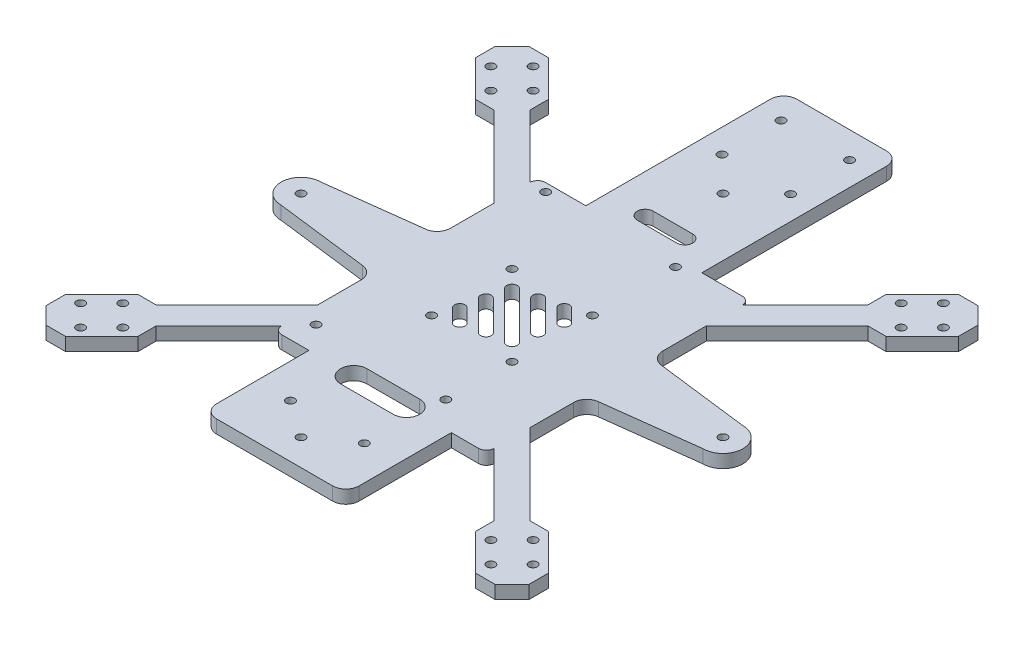
from build123d import *

# Parameters (mm, degrees)
SKETCH_1_R          = 1.6
EXTRUDE_1_DEPTH     = 5
SKETCH_6_R          = 1.6
EXTRUDE_3_DEPTH     = 5
SKETCH_7_R          = 1.6
CUT_EXTRUDE_5_DEPTH = 130.541966274
SKETCH_8_W          = 44
SKETCH_8_H          = 75
SKETCH_8_R          = 1.6
EXTRUDE_4_DEPTH     = 5
FILLET_1_R          = 5
FILLET_2_R          = 3


with BuildPart() as part:
    # 草图1 → 凸台-拉伸1 (new body)
    with BuildSketch(Plane(origin=(0, 0, 0), x_dir=(1, 0, 0), z_dir=(0, 1, 0))):
        with BuildLine():
            Line((-40.28, -16.916429648), (-40.28, -50))
            Line((-40.28, -50), (-27, -50))
            Line((-27, -50), (-27, -90))
            Line((-27, -90), (27, -90))
            Line((27, -90), (27, -50))
            Line((27, -50), (40.28, -50))
            Line((40.28, -50), (40.28, -16.916429648))
            ThreePointArc((40.28, -16.916429648), (41.5325458, -13.606356081), (44.662634807, -11.954690012))
            Line((44.662634807, -11.954690012), (80, -7.557833088))
            ThreePointArc((80, -7.557833088), (87.557833088, 0), (80, 7.557833088))
            Line((80, 7.557833088), (44.662634807, 11.954690012))
            ThreePointArc((44.662634807, 11.954690012), (41.5325458, 13.606356081), (40.28, 16.916429648))
            Line((40.28, 16.916429648), (40.28, 50))
            Line((40.28, 50), (-40.28, 50))
            Line((-40.28, 50), (-40.28, 16.916429648))
            ThreePointArc((-40.28, 16.916429648), (-41.5325458, 13.606356081), (-44.662634807, 11.954690012))
            Line((-44.662634807, 11.954690012), (-80, 7.557833088))
            ThreePointArc((-80, 7.557833088), (-87.557833088, 0), (-80, -7.557833088))
            Line((-80, -7.557833088), (-44.662634807, -11.954690012))
            ThreePointArc((-44.662634807, -11.954690012), (-41.5325458, -13.606356081), (-40.28, -16.916429648))
        make_face()
        with Locations(Location((-34.12, -40.19, 0), (0, 0, 270))):
            Circle(SKETCH_1_R, mode=Mode.SUBTRACT)
        with Locations(Location((15.09, -40.19, 0), (0, 0, 270))):
            Circle(SKETCH_1_R, mode=Mode.SUBTRACT)
        with Locations(Location((-80, 0, 0), (0, 0, 270))):
            Circle(SKETCH_1_R, mode=Mode.SUBTRACT)
        with Locations(Location((-15.25, -15.25, 0), (0, 0, 270))):
            Circle(SKETCH_1_R, mode=Mode.SUBTRACT)
        with Locations(Location((-15.25, 15.25, 0), (0, 0, 270))):
            Circle(SKETCH_1_R, mode=Mode.SUBTRACT)
        with Locations(Location((-34.12, 46.89, 0), (0, 0, 270))):
            Circle(SKETCH_1_R, mode=Mode.SUBTRACT)
        with Locations(Location((15.25, -15.25, 0), (0, 0, 270))):
            Circle(SKETCH_1_R, mode=Mode.SUBTRACT)
        with Locations(Location((80, 0, 0), (0, 0, 270))):
            Circle(SKETCH_1_R, mode=Mode.SUBTRACT)
        with Locations(Location((15.25, 15.25, 0), (0, 0, 270))):
            Circle(SKETCH_1_R, mode=Mode.SUBTRACT)
        with Locations(Location((15.09, 46.89, 0), (0, 0, 270))):
            Circle(SKETCH_1_R, mode=Mode.SUBTRACT)
        with Locations(Location((14, -70, 0), (0, 0, 270))):
            Circle(SKETCH_1_R, mode=Mode.SUBTRACT)
        with Locations(Location((-14, -70, 0), (0, 0, 270))):
            Circle(SKETCH_1_R, mode=Mode.SUBTRACT)
    extrude(amount=EXTRUDE_1_DEPTH)

    # 草图6 → 凸台-拉伸3 (add)
    # profile 1 of 4: a face of its own
    with BuildSketch(Plane(origin=(0, 0, 0), x_dir=(1, 0, 0), z_dir=(0, 1, 0))):
        Polygon((-40.28, 33.405), (-40.28, 47.155), (-64.031745931, 70.906745931), (-64.031745931, 77.781745931), (-77.781745931, 91.531745931), (-85.1677849, 91.531745931), (-91.531745931, 85.1677849), (-91.531745931, 77.781745931), (-77.781745931, 64.031745931), (-70.906745931, 64.031745931), align=None)
        with Locations(Location((-85.781745931, 77.781745931, 0), (0, 0, 270))):
            Circle(SKETCH_6_R, mode=Mode.SUBTRACT)
        with Locations(Location((-77.781745931, 69.781745931, 0), (0, 0, 270))):
            Circle(SKETCH_6_R, mode=Mode.SUBTRACT)
        with Locations(Location((-69.781745931, 77.781745931, 0), (0, 0, 270))):
            Circle(SKETCH_6_R, mode=Mode.SUBTRACT)
        with Locations(Location((-77.781745931, 85.781745931, 0), (0, 0, 270))):
            Circle(SKETCH_6_R, mode=Mode.SUBTRACT)
    # profile 2 of 4: a face of its own
    with BuildSketch(Plane(origin=(0, 0, 0), x_dir=(1, 0, 0), z_dir=(0, 1, 0))):
        Polygon((85.1677849, 91.531745931), (77.781745931, 91.531745931), (64.031745931, 77.781745931), (64.031745931, 70.906745931), (40.28, 47.155), (40.28, 33.405), (70.906745931, 64.031745931), (77.781745931, 64.031745931), (91.531745931, 77.781745931), (91.531745931, 85.1677849), align=None)
        with Locations(Location((77.781745931, 69.781745931, 0), (0, 0, 270))):
            Circle(SKETCH_6_R, mode=Mode.SUBTRACT)
        with Locations(Location((69.781745931, 77.781745931, 0), (0, 0, 270))):
            Circle(SKETCH_6_R, mode=Mode.SUBTRACT)
        with Locations(Location((85.781745931, 77.781745931, 0), (0, 0, 270))):
            Circle(SKETCH_6_R, mode=Mode.SUBTRACT)
        with Locations(Location((77.781745931, 85.781745931, 0), (0, 0, 270))):
            Circle(SKETCH_6_R, mode=Mode.SUBTRACT)
    # profile 3 of 4: a face of its own
    with BuildSketch(Plane(origin=(0, 0, 0), x_dir=(1, 0, 0), z_dir=(0, 1, 0))):
        Polygon((70.906745931, -64.031745931), (40.28, -33.405), (40.28, -47.155), (64.031745931, -70.906745931), (64.031745931, -77.781745931), (77.781745931, -91.531745931), (85.1677849, -91.531745931), (91.531745931, -85.1677849), (91.531745931, -77.781745931), (77.781745931, -64.031745931), align=None)
        with Locations(Location((77.781745931, -85.781745931, 0), (0, 0, 270))):
            Circle(SKETCH_6_R, mode=Mode.SUBTRACT)
        with Locations(Location((69.781745931, -77.781745931, 0), (0, 0, 270))):
            Circle(SKETCH_6_R, mode=Mode.SUBTRACT)
        with Locations(Location((77.781745931, -69.781745931, 0), (0, 0, 270))):
            Circle(SKETCH_6_R, mode=Mode.SUBTRACT)
        with Locations(Location((85.781745931, -77.781745931, 0), (0, 0, 270))):
            Circle(SKETCH_6_R, mode=Mode.SUBTRACT)
    # profile 4 of 4: a face of its own
    with BuildSketch(Plane(origin=(0, 0, 0), x_dir=(1, 0, 0), z_dir=(0, 1, 0))):
        Polygon((-40.28, -47.155), (-40.28, -33.405), (-70.906745931, -64.031745931), (-77.781745931, -64.031745931), (-91.531745931, -77.781745931), (-91.531745931, -85.1677849), (-85.1677849, -91.531745931), (-77.781745931, -91.531745931), (-64.031745931, -77.781745931), (-64.031745931, -70.906745931), align=None)
        with Locations(Location((-77.781745931, -85.781745931, 0), (0, 0, 270))):
            Circle(SKETCH_6_R, mode=Mode.SUBTRACT)
        with Locations(Location((-85.781745931, -77.781745931, 0), (0, 0, 270))):
            Circle(SKETCH_6_R, mode=Mode.SUBTRACT)
        with Locations(Location((-69.781745931, -77.781745931, 0), (0, 0, 270))):
            Circle(SKETCH_6_R, mode=Mode.SUBTRACT)
        with Locations(Location((-77.781745931, -69.781745931, 0), (0, 0, 270))):
            Circle(SKETCH_6_R, mode=Mode.SUBTRACT)
    extrude(amount=EXTRUDE_3_DEPTH)

    # 草图7 → 切除-拉伸5 (cut, through all)
    with BuildSketch(Plane(origin=(0, 0, 0), x_dir=(1, 0, 0), z_dir=(0, 1, 0))):
        with BuildLine():
            ThreePointArc((-6.01040764, -10.960155108), (-6.01040764, -13.788582233), (-8.838834765, -13.788582233))
            Line((-8.838834765, -13.788582233), (-13.788582233, -8.838834765))
            ThreePointArc((-13.788582233, -8.838834765), (-13.788582233, -6.01040764), (-10.960155108, -6.01040764))
            Line((-10.960155108, -6.01040764), (-6.01040764, -10.960155108))
        make_face()
        with BuildLine():
            ThreePointArc((2.121320344, -9.192388155), (2.121320344, -12.02081528), (-0.707106781, -12.02081528))
            Line((-0.707106781, -12.02081528), (-12.02081528, -0.707106781))
            ThreePointArc((-12.02081528, -0.707106781), (-12.02081528, 2.121320344), (-9.192388155, 2.121320344))
            Line((-9.192388155, 2.121320344), (2.121320344, -9.192388155))
        make_face()
        with BuildLine():
            Line((-10.253048327, 7.424621202), (7.424621202, -10.253048327))
            ThreePointArc((7.424621202, -10.253048327), (10.253048327, -10.253048327), (10.253048327, -7.424621202))
            Line((10.253048327, -7.424621202), (-7.424621202, 10.253048327))
            ThreePointArc((-7.424621202, 10.253048327), (-10.253048327, 10.253048327), (-10.253048327, 7.424621202))
        make_face()
        with BuildLine():
            Line((-2.121320344, 9.192388155), (9.192388155, -2.121320344))
            ThreePointArc((9.192388155, -2.121320344), (12.02081528, -2.121320344), (12.02081528, 0.707106781))
            Line((12.02081528, 0.707106781), (0.707106781, 12.02081528))
            ThreePointArc((0.707106781, 12.02081528), (-2.121320344, 12.02081528), (-2.121320344, 9.192388155))
        make_face()
        with BuildLine():
            Line((6.01040764, 10.960155108), (10.960155108, 6.01040764))
            ThreePointArc((10.960155108, 6.01040764), (13.788582233, 6.01040764), (13.788582233, 8.838834765))
            Line((13.788582233, 8.838834765), (8.838834765, 13.788582233))
            ThreePointArc((8.838834765, 13.788582233), (6.01040764, 13.788582233), (6.01040764, 10.960155108))
        make_face()
        with BuildLine():
            Line((-10, -55), (10, -55))
            ThreePointArc((10, -55), (15, -50), (10, -45))
            Line((10, -45), (-10, -45))
            ThreePointArc((-10, -45), (-15, -50), (-10, -55))
        make_face()
        with Locations(Location((0, -80, 0), (0, 0, 270))):
            Circle(SKETCH_7_R)
    extrude(amount=CUT_EXTRUDE_5_DEPTH, mode=Mode.SUBTRACT)

    # 草图8 → 凸台-拉伸4 (add)
    with BuildSketch(Plane(origin=(0, 0, 0), x_dir=(1, 0, 0), z_dir=(0, 1, 0))):
        with Locations((0, 87.5)):
            Rectangle(SKETCH_8_W, SKETCH_8_H)
        with Locations(Location((13, 115, 0), (0, 0, 270))):
            Circle(SKETCH_8_R, mode=Mode.SUBTRACT)
        with Locations(Location((-13, 115, 0), (0, 0, 90))):
            Circle(SKETCH_8_R, mode=Mode.SUBTRACT)
        with Locations(Location((13, 92.63, 0), (0, 0, 270))):
            Circle(SKETCH_8_R, mode=Mode.SUBTRACT)
        with Locations(Location((-13, 92.63, 0), (0, 0, 90))):
            Circle(SKETCH_8_R, mode=Mode.SUBTRACT)
        with Locations(Location((0, 80, 0), (0, 0, 270))):
            Circle(SKETCH_8_R, mode=Mode.SUBTRACT)
        with BuildLine():
            Line((-7.5, 61), (7.5, 61))
            ThreePointArc((7.5, 61), (10.5, 58), (7.5, 55))
            Line((7.5, 55), (-7.5, 55))
            ThreePointArc((-7.5, 55), (-10.5, 58), (-7.5, 61))
        make_face(mode=Mode.SUBTRACT)
    extrude(amount=EXTRUDE_4_DEPTH)

    # 圆角1
    fillet_1_edges = [part.edges().sort_by_distance(p)[0] for p in [
        (22, 2.5, -125),
        (-22, 2.5, -125),
        (27, 2.5, 90),
        (-27, 2.5, 90),
    ]]
    fillet(fillet_1_edges, radius=FILLET_1_R)

    # 圆角2
    # the kernel refuses this fillet: 3 mm, written as the material it takes off along each edge
    with BuildSketch(Plane(origin=(-40.28, -7.489982894, 50), x_dir=(1, 0, 0), z_dir=(0, 1, 0))) as fillet_2_piece_1_section:
        with BuildLine():
            CenterArc((2.995993158, 3), FILLET_2_R, 182.961600578, 87.038399422)
            Line((0, 2.845), (-0.059919863, 2.8419))
            ThreePointArc((-0.059919863, 2.8419), (-0.06, 1.4225), (-0.06, 0))
            Line((-0.06, 0), (0, -0.06))
            Line((0, -0.06), (2.995993158, -0.06))
            Line((2.995993158, -0.06), (2.995993158, 0))
        make_face()
    fillet_2_piece_1 = extrude(amount=19.979965788, mode=Mode.PRIVATE)
    fillet_2_piece_1 = split(fillet_2_piece_1, bisect_by=Plane(origin=(-41.028477844, 2.5, 47.903477844), z_dir=(0.7071067811865611, 0, 0.7071067811865339)), keep=Keep.TOP, mode=Mode.PRIVATE)
    add(fillet_2_piece_1, mode=Mode.SUBTRACT)
    with BuildSketch(Plane(origin=(40.28, -7.489982894, 50), x_dir=(-1, 0, 0), z_dir=(0, 1, 0))) as fillet_2_piece_2_section:
        with BuildLine():
            CenterArc((2.995993158, -3), FILLET_2_R, 90, 87.038399422)
            Line((0, -2.845), (-0.059919863, -2.8419))
            ThreePointArc((-0.059919863, -2.8419), (-0.06, -1.4225), (-0.06, 0))
            Line((-0.06, 0), (0, 0.06))
            Line((0, 0.06), (2.995993158, 0.06))
            Line((2.995993158, 0.06), (2.995993158, 0))
        make_face()
    fillet_2_piece_2 = extrude(amount=19.979965788, mode=Mode.PRIVATE)
    fillet_2_piece_2 = split(fillet_2_piece_2, bisect_by=Plane(origin=(41.028477844, 2.5, 47.903477844), z_dir=(-0.7071067811865506, 0, 0.7071067811865445)), keep=Keep.TOP, mode=Mode.PRIVATE)
    add(fillet_2_piece_2, mode=Mode.SUBTRACT)
    with BuildSketch(Plane(origin=(40.28, -7.489982894, -50), x_dir=(0, 0, 1), z_dir=(0, 1, 0))) as fillet_2_piece_3_section:
        with BuildLine():
            CenterArc((3, -2.995993158), FILLET_2_R, 92.961600577, 87.038399423)
            Line((0, -2.995993158), (-0.06, -2.995993158))
            Line((-0.06, -2.995993158), (-0.06, 0))
            Line((-0.06, 0), (0, 0.06))
            ThreePointArc((0, 0.06), (1.4225, 0.06), (2.8419, 0.059919863))
            Line((2.8419, 0.059919863), (2.845, 0))
        make_face()
    fillet_2_piece_3 = extrude(amount=19.979965788, mode=Mode.PRIVATE)
    fillet_2_piece_3 = split(fillet_2_piece_3, bisect_by=Plane(origin=(41.028477844, 2.5, -47.903477844), z_dir=(-0.7071067811865489, 0, -0.7071067811865461)), keep=Keep.TOP, mode=Mode.PRIVATE)
    add(fillet_2_piece_3, mode=Mode.SUBTRACT)
    with BuildSketch(Plane(origin=(-40.28, -7.489982894, -50), x_dir=(0, 0, 1), z_dir=(0, 1, 0))) as fillet_2_piece_4_section:
        with BuildLine():
            CenterArc((3, 2.995993158), FILLET_2_R, 180, 87.038399422)
            Line((0, 2.995993158), (-0.06, 2.995993158))
            Line((-0.06, 2.995993158), (-0.06, 0))
            Line((-0.06, 0), (0, -0.06))
            ThreePointArc((0, -0.06), (1.4225, -0.06), (2.8419, -0.059919863))
            Line((2.8419, -0.059919863), (2.845, 0))
        make_face()
    fillet_2_piece_4 = extrude(amount=19.979965788, mode=Mode.PRIVATE)
    fillet_2_piece_4 = split(fillet_2_piece_4, bisect_by=Plane(origin=(-41.028477844, 2.5, -47.903477844), z_dir=(0.7071067811865613, 0, -0.7071067811865338)), keep=Keep.TOP, mode=Mode.PRIVATE)
    add(fillet_2_piece_4, mode=Mode.SUBTRACT)


solid = part.part
